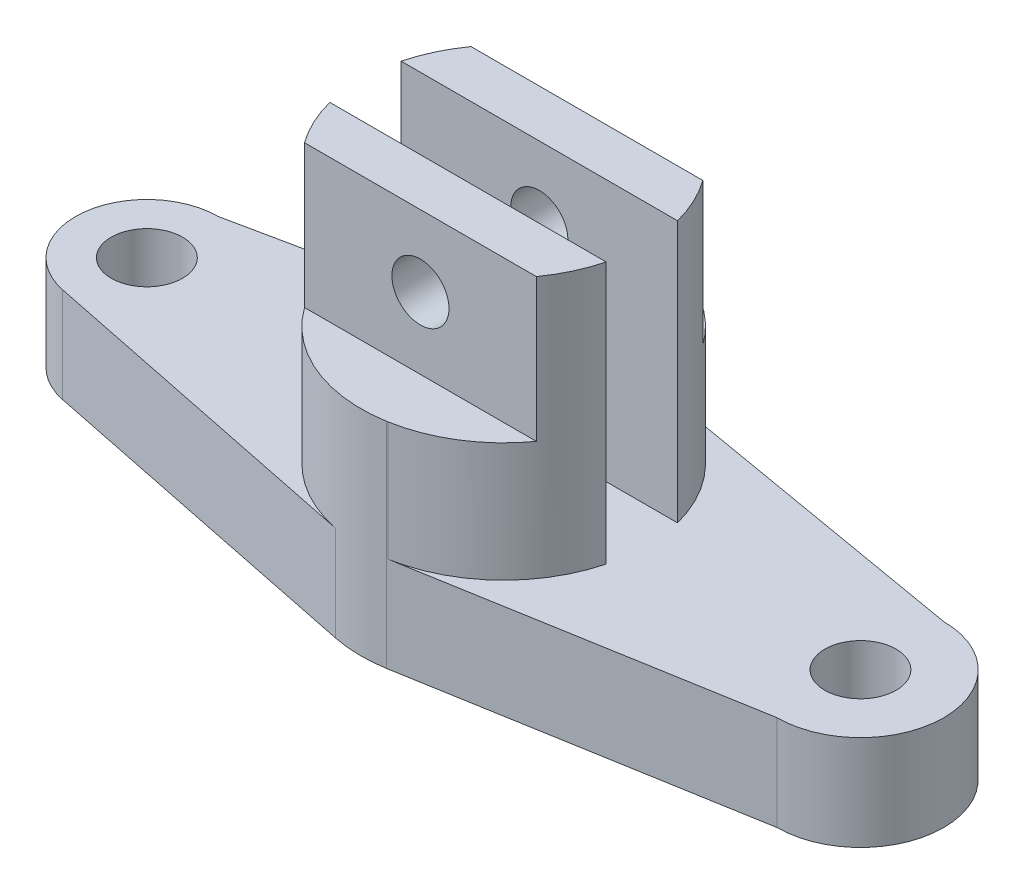
from build123d import *

# Parameters (mm, degrees)
SALIENTE_EXTRUIR1_OUTLINE_R = 7.5
SALIENTE_EXTRUIR1_DEPTH     = 20
SALIENTE_EXTRUIR2_START     = 20
CROQUIS2_4_R                = 7.5
SALIENTE_EXTRUIR2_DEPTH     = 25
SALIENTE_EXTRUIR3_START     = 45
SALIENTE_EXTRUIR3_DEPTH     = 30
CORTAR_EXTRUIR1_DEPTH       = 123.805740908
CORTAR_EXTRUIR1_DEPTH_BACK  = 123.805740908
CROQUIS3_R                  = 6


# Read off the part's stored shape, not the designer's step: Saliente-Extruir1
with BuildPart() as part:
    # Saliente-Extruir1 outline → Saliente-Extruir1 (new body)
    with BuildSketch(Plane(origin=(0, 0, 0), x_dir=(1, 0, 0), z_dir=(0, 1, 0))):
        with BuildLine():
            Line((75, 17.5), (4.980303505, 29.583721487))
            ThreePointArc((4.980303505, 29.583721487), (-0.583157592, 29.994331585), (-6.126453941, 29.367781021))
            Line((-6.126453941, 29.367781021), (-75, 15))
            ThreePointArc((-75, 15), (-89.924042295, 1.50763443), (-78, -14.696938457))
            Line((-78, -14.696938457), (-6, -29.393876913))
            ThreePointArc((-6, -29.393876913), (-0.518609175, -29.995517074), (4.980303505, -29.583721487))
            Line((4.980303505, -29.583721487), (75, -17.5))
            ThreePointArc((75, -17.5), (92.5, 0), (75, 17.5))
        make_face()
        with Locations((-75, 0)):
            Circle(SALIENTE_EXTRUIR1_OUTLINE_R, mode=Mode.SUBTRACT)
        with Locations((75, 0)):
            Circle(SALIENTE_EXTRUIR1_OUTLINE_R, mode=Mode.SUBTRACT)
    extrude(amount=SALIENTE_EXTRUIR1_DEPTH)

    # Croquis2<4> → Saliente-Extruir2 (add)
    with BuildSketch(Plane(origin=(0, 0, 0), x_dir=(1, 0, 0), z_dir=(0, 1, 0)).offset(SALIENTE_EXTRUIR2_START)):
        with Locations(Location((-75, 0, 0), (0, 0, 270))):
            Circle(CROQUIS2_4_R)
        with Locations(Location((75, 0, 0), (0, 0, 270))):
            Circle(CROQUIS2_4_R)
        with BuildLine():
            Line((29.047375097, 7.5), (-29.047375097, 7.5))
            ThreePointArc((-29.047375097, 7.5), (0, 30), (29.047375097, 7.5))
        make_face()
        with BuildLine():
            Line((-29.047375097, -7.5), (29.047375097, -7.5))
            ThreePointArc((29.047375097, -7.5), (0, -30), (-29.047375097, -7.5))
        make_face()
    extrude(amount=SALIENTE_EXTRUIR2_DEPTH)


with BuildPart() as saliente_extruir2_kept_piece:
    # of the separate pieces the step leaves, the one the design keeps (saliente_extruir2_pieces_kept)
    add(part.part.solids().sort_by_distance((4.980303505, 0, 29.583721487))[0])

    # Croquis2<5> → Saliente-Extruir3 (add)
    with BuildSketch(Plane(origin=(0, 0, 0), x_dir=(1, 0, 0), z_dir=(0, 1, 0)).offset(SALIENTE_EXTRUIR3_START)):
        with BuildLine():
            Line((24.366985862, 17.5), (-24.366985862, 17.5))
            ThreePointArc((-24.366985862, 17.5), (-27.171188586, 12.717173855), (-29.047375097, 7.5))
            Line((-29.047375097, 7.5), (29.047375097, 7.5))
            ThreePointArc((29.047375097, 7.5), (27.171188586, 12.717173855), (24.366985862, 17.5))
        make_face()
        with BuildLine():
            ThreePointArc((-29.047375097, -7.5), (-27.171188586, -12.717173855), (-24.366985862, -17.5))
            Line((-24.366985862, -17.5), (24.366985862, -17.5))
            ThreePointArc((24.366985862, -17.5), (27.171188586, -12.717173855), (29.047375097, -7.5))
            Line((29.047375097, -7.5), (-29.047375097, -7.5))
        make_face()
    extrude(amount=SALIENTE_EXTRUIR3_DEPTH)

    # Croquis3 → Cortar-Extruir1 (cut, two sides: drawn at the far end of the back side and taken through both)
    with BuildSketch(Plane.XY.offset(-CORTAR_EXTRUIR1_DEPTH_BACK)):
        with Locations((0, 60)):
            Circle(CROQUIS3_R)
    extrude(amount=CORTAR_EXTRUIR1_DEPTH + CORTAR_EXTRUIR1_DEPTH_BACK, mode=Mode.SUBTRACT)


solid = saliente_extruir2_kept_piece.part
